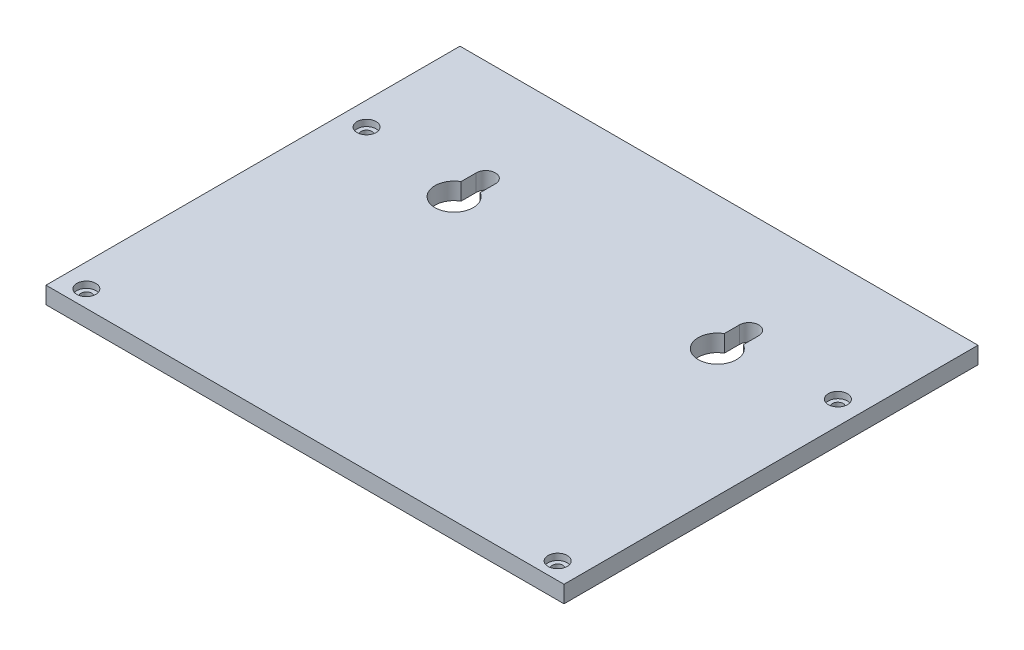
from build123d import *

# Parameters (mm, degrees)
SKETCH1_W           = 122
SKETCH1_H           = 97.5
BOSS_EXTRUDE1_DEPTH = 4
SKETCH2_R           = 1.25
CUT_EXTRUDE1_DEPTH  = 4
SKETCH3_R           = 2.25
CUT_EXTRUDE2_DEPTH  = 1.5
CUT_EXTRUDE3_DEPTH  = 4


with BuildPart() as part:
    # Sketch1 → Boss-Extrude1 (new body)
    with BuildSketch(Plane(origin=(0, 0, 0), x_dir=(1, 0, 0), z_dir=(0, 1, 0))):
        with Locations((-30.40625, -8.671875)):
            Rectangle(SKETCH1_W, SKETCH1_H)
    extrude(amount=BOSS_EXTRUDE1_DEPTH)

    # Sketch2 → Cut-Extrude1 (cut)
    with BuildSketch(Plane(origin=(0, 4, 0), x_dir=(1, 0, 0), z_dir=(0, 1, 0))):
        with Locations((-85.90625, -53.421875)):
            Circle(SKETCH2_R)
        with Locations((-85.90625, 12.578125)):
            Circle(SKETCH2_R)
        with Locations((25.09375, 12.578125)):
            Circle(SKETCH2_R)
        with Locations((25.09375, -53.421875)):
            Circle(SKETCH2_R)
    extrude(amount=-CUT_EXTRUDE1_DEPTH, mode=Mode.SUBTRACT)

    # Sketch3 → Cut-Extrude2 (cut)
    with BuildSketch(Plane(origin=(0, 4, 0), x_dir=(1, 0, 0), z_dir=(0, 1, 0))):
        with Locations((-85.90625, 12.578125)):
            Circle(SKETCH3_R)
        with Locations((-85.90625, -53.421875)):
            Circle(SKETCH3_R)
        with Locations((25.09375, -53.421875)):
            Circle(SKETCH3_R)
        with Locations((25.09375, 12.578125)):
            Circle(SKETCH3_R)
    extrude(amount=-CUT_EXTRUDE2_DEPTH, mode=Mode.SUBTRACT)

    # Sketch4 → Cut-Extrude3 (cut)
    with BuildSketch(Plane(origin=(0, 4, 0), x_dir=(1, 0, 0), z_dir=(0, 1, 0))):
        with BuildLine():
            Line((-1.65625, 16.157315761), (-1.65625, 12.586287383))
            ThreePointArc((-1.65625, 12.586287383), (0.59375, 4.18990801), (2.84375, 12.586287383))
            Line((2.84375, 12.586287383), (2.84375, 16.157315761))
            ThreePointArc((2.84375, 16.157315761), (0.59375, 18.407315761), (-1.65625, 16.157315761))
        make_face()
        with BuildLine():
            Line((-63.65625, 16.157315761), (-63.65625, 12.586287383))
            ThreePointArc((-63.65625, 12.586287383), (-61.40625, 4.18990801), (-59.15625, 12.586287383))
            Line((-59.15625, 12.586287383), (-59.15625, 16.157315761))
            ThreePointArc((-59.15625, 16.157315761), (-61.40625, 18.407315761), (-63.65625, 16.157315761))
        make_face()
    extrude(amount=-CUT_EXTRUDE3_DEPTH, mode=Mode.SUBTRACT)


solid = part.part
